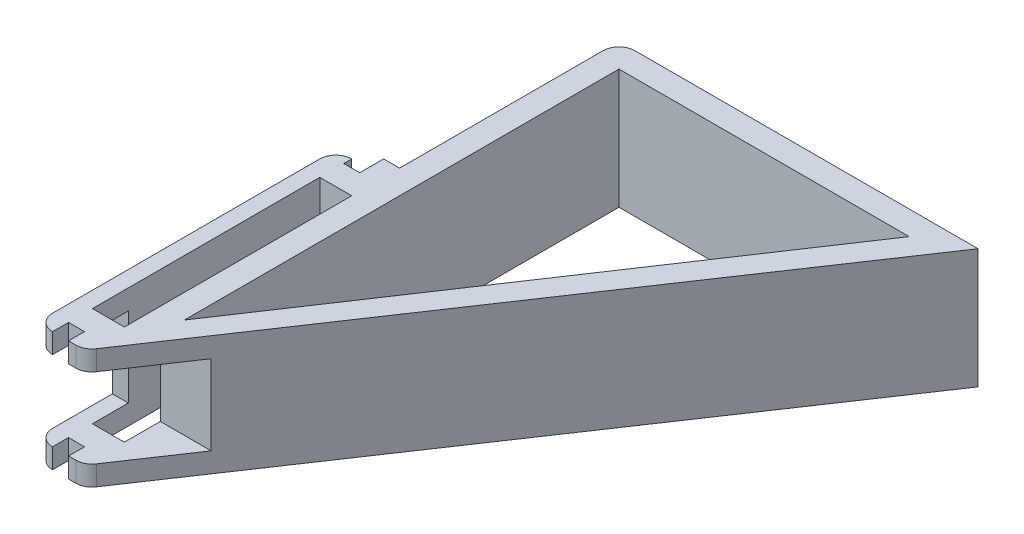
from build123d import *

# Parameters (mm, degrees)
SKETCH2_W               = 4
SKETCH2_H               = 28.5
BOSS_EXTRUDE1_DEPTH     = 15
CUT_EXTRUDE1_DEPTH      = 86.527773267
CUT_EXTRUDE1_DEPTH_BACK = 15
SKETCH3_W               = 9.5
SKETCH3_H               = 10
FILLET1_R               = 2
FILLET2_R               = 2
FILLET3_R               = 2
FILLET4_R               = 2
FILLET5_R               = 2
FILLET6_R               = 2


with BuildPart() as part:
    # Sketch2 → Boss-Extrude1 (new body)
    with BuildSketch(Plane(origin=(0, 0, 0), x_dir=(1, 0, 0), z_dir=(0, 1, 0))):
        Polygon((0, 0), (0, 2), (2, 2), (2, 0), (4, 0), (49, 67), (4, 67), (4, 39.5), (2, 39.5), (2, 36.5), (0, 36.5), (0, 37.5), (-2, 37.5), (-2, 0), align=None)
        with Locations((2, 19.25)):
            Rectangle(SKETCH2_W, SKETCH2_H, mode=Mode.SUBTRACT)
        Polygon((7, 64), (43.371222906, 64), (7, 9.516238481), align=None, mode=Mode.SUBTRACT)
    extrude(amount=BOSS_EXTRUDE1_DEPTH)

    # Sketch3 → Cut-Extrude1 (cut, two sides: drawn at the far end of the back side and taken through both)
    with BuildSketch(Plane.ZY.offset(2).offset(-CUT_EXTRUDE1_DEPTH_BACK)):
        with Locations((-4.75, 7.5)):
            Rectangle(SKETCH3_W, SKETCH3_H)
    extrude(amount=CUT_EXTRUDE1_DEPTH + CUT_EXTRUDE1_DEPTH_BACK, mode=Mode.SUBTRACT)

    # Fillet1
    fillet1_edges = [part.edges().sort_by_distance(p)[0] for p in [
        (-2, 7.5, -37.5),
    ]]
    fillet(fillet1_edges, radius=FILLET1_R - 0.0001)  # a hair under: the kernel refuses the full size

    # Fillet2
    fillet2_edges = [part.edges().sort_by_distance(p)[0] for p in [
        (4, 7.5, -67),
    ]]
    fillet(fillet2_edges, radius=FILLET2_R)

    # Fillet3
    fillet3_edges = [part.edges().sort_by_distance(p)[0] for p in [
        (4, 1.25, 0),
    ]]
    fillet(fillet3_edges, radius=FILLET3_R)

    # Fillet4
    fillet4_edges = [part.edges().sort_by_distance(p)[0] for p in [
        (4, 13.75, 0),
    ]]
    fillet(fillet4_edges, radius=FILLET4_R)

    # Fillet5
    fillet5_edges = [part.edges().sort_by_distance(p)[0] for p in [
        (-2, 13.75, 0),
    ]]
    fillet(fillet5_edges, radius=FILLET5_R - 0.0001)  # a hair under: the kernel refuses the full size

    # Fillet6
    fillet6_edges = [part.edges().sort_by_distance(p)[0] for p in [
        (-2, 1.25, 0),
    ]]
    fillet(fillet6_edges, radius=FILLET6_R - 0.0001)  # a hair under: the kernel refuses the full size


solid = part.part
